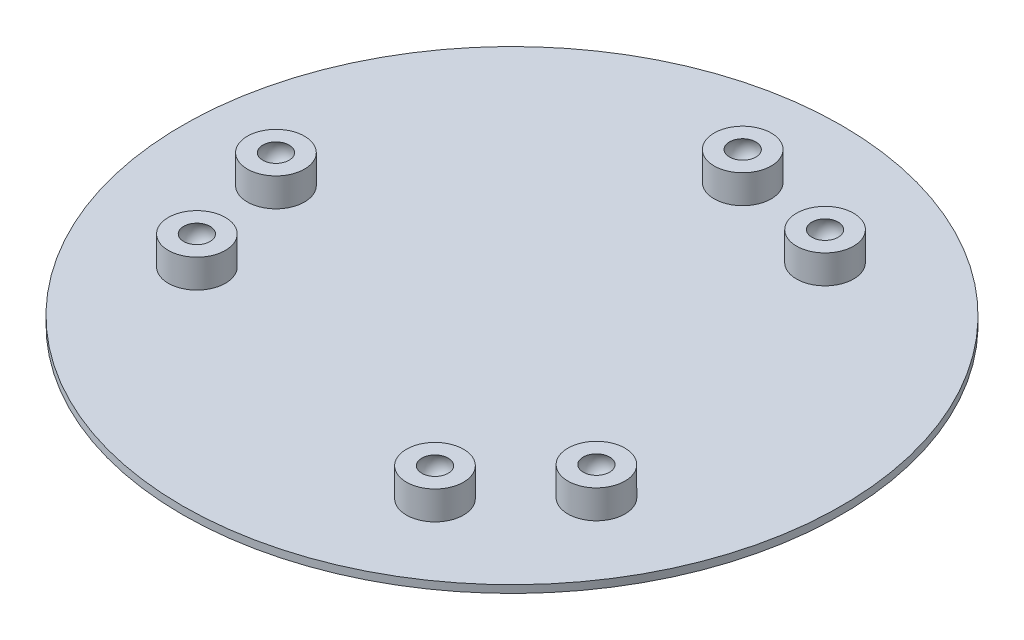
from build123d import *

# Parameters (mm, degrees)
SKETCH1_R          = 866.025405
EXTRUDE1_DEPTH     = 20
SKETCH2_R          = 75
CUT_EXTRUDE1_DEPTH = 10


# Read off the part's stored shape, not the designer's step: 连接重组1
with BuildPart() as part:
    # Sketch1 → Extrude1 (new body)
    with BuildSketch(Plane(origin=(0, 0, 0), x_dir=(1, 0, 0), z_dir=(0, 1, 0))):
        with Locations(Location((0, 0, 0), (0, 0, 270))):
            Circle(SKETCH1_R)
    extrude(amount=-EXTRUDE1_DEPTH)

    # Sketch2 → Cut-Extrude1 (cut)
    with BuildSketch(Plane(origin=(0, 0, 0), x_dir=(1, 0, 0), z_dir=(0, 1, 0))):
        with Locations(Location((0, 606.2177835, 0), (0, 0, 270))):
            Circle(SKETCH2_R)
        with Locations(Location((290.671285018, 531.987034708, 0), (0, 0, 270))):
            Circle(SKETCH2_R)
        with Locations(Location((525.000000737, -303.10889175, 0), (0, 0, 270))):
            Circle(SKETCH2_R)
        with Locations(Location((315.378644033, -517.72223433, 0), (0, 0, 270))):
            Circle(SKETCH2_R)
        with Locations(Location((-525.000000737, -303.10889175, 0), (0, 0, 270))):
            Circle(SKETCH2_R)
        with Locations(Location((-606.04992905, -14.264800378, 0), (0, 0, 270))):
            Circle(SKETCH2_R)
    extrude(amount=-CUT_EXTRUDE1_DEPTH, mode=Mode.SUBTRACT)

    # 连接重组1 outline → 连接重组1 (revolve)
    with BuildSketch(Plane.XY.offset(-606.2177835)):
        with BuildLine():
            Line((75, 75), (34.641016131, 75.000000035))
            ThreePointArc((34.641016131, 75.000000035), (34.641016161, 35.000000018), (0, 15))
            Line((0, 15), (0, -10))
            Line((0, -10), (75, -10))
            Line((75, -10), (75, 75))
        make_face()
    revolve(axis=Axis((0, 0, -606.2177835), (0, 1, 0)))

    # Other 1 2 outline → Other 1 2 (revolve)
    with BuildSketch(Plane(origin=(290.671285018, 0, -531.987034708), x_dir=(1, 0, 0), z_dir=(0, 0, 1))):
        with BuildLine():
            Line((75, 75), (34.641016131, 75.000000035))
            ThreePointArc((34.641016131, 75.000000035), (34.641016161, 35.000000018), (0, 15))
            Line((0, 15), (0, -10))
            Line((0, -10), (75, -10))
            Line((75, -10), (75, 75))
        make_face()
    revolve(axis=Axis((290.671285018, 0, -531.987034708), (0, 1, 0)))

    # Other 1 3 outline → Other 1 3 (revolve)
    with BuildSketch(Plane(origin=(315.378644033, 0, 517.72223433), x_dir=(1, 0, 0), z_dir=(0, 0, 1))):
        with BuildLine():
            Line((75, 75), (34.641016131, 75.000000035))
            ThreePointArc((34.641016131, 75.000000035), (34.641016161, 35.000000018), (0, 15))
            Line((0, 15), (0, -10))
            Line((0, -10), (75, -10))
            Line((75, -10), (75, 75))
        make_face()
    revolve(axis=Axis((315.378644033, 0, 517.72223433), (0, 1, 0)))

    # Other 1 4 outline → Other 1 4 (revolve)
    with BuildSketch(Plane(origin=(-525.000000737, 0, 303.10889175), x_dir=(1, 0, 0), z_dir=(0, 0, 1))):
        with BuildLine():
            Line((75, 75), (34.641016131, 75.000000035))
            ThreePointArc((34.641016131, 75.000000035), (34.641016161, 35.000000018), (0, 15))
            Line((0, 15), (0, -10))
            Line((0, -10), (75, -10))
            Line((75, -10), (75, 75))
        make_face()
    revolve(axis=Axis((-525.000000737, 0, 303.10889175), (0, 1, 0)))

    # Other 1 5 outline → Other 1 5 (revolve)
    with BuildSketch(Plane(origin=(-606.04992905, 0, 14.264800378), x_dir=(1, 0, 0), z_dir=(0, 0, 1))):
        with BuildLine():
            Line((75, 75), (34.641016131, 75.000000035))
            ThreePointArc((34.641016131, 75.000000035), (34.641016161, 35.000000018), (0, 15))
            Line((0, 15), (0, -10))
            Line((0, -10), (75, -10))
            Line((75, -10), (75, 75))
        make_face()
    revolve(axis=Axis((-606.04992905, 0, 14.264800378), (0, 1, 0)))

    # Other 1 6 outline → Other 1 6 (revolve)
    with BuildSketch(Plane(origin=(525.000000737, 0, 303.10889175), x_dir=(1, 0, 0), z_dir=(0, 0, 1))):
        with BuildLine():
            Line((75, 75), (34.641016131, 75.000000035))
            ThreePointArc((34.641016131, 75.000000035), (34.641016161, 35.000000018), (0, 15))
            Line((0, 15), (0, -10))
            Line((0, -10), (75, -10))
            Line((75, -10), (75, 75))
        make_face()
    revolve(axis=Axis((525.000000737, 0, 303.10889175), (0, 1, 0)))


solid = part.part
